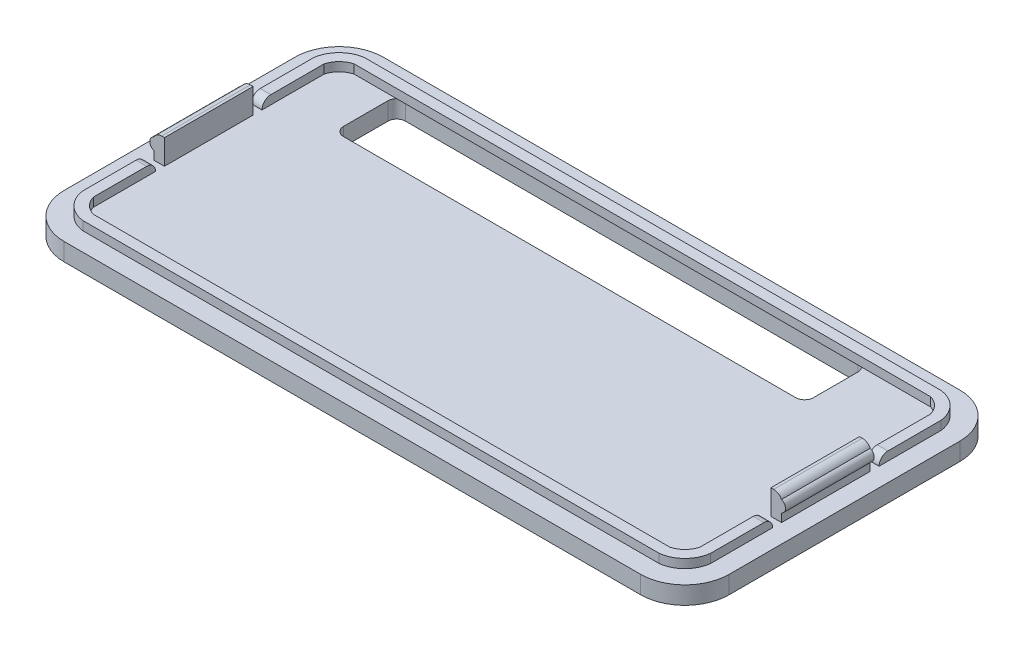
from build123d import *

# Parameters (mm, degrees)
EXTRUDE_2_DEPTH     = 2
EXTRUDE_4_DEPTH     = 1
SKETCH_7_W          = 1.2
SKETCH_7_H          = 10
EXTRUDE_8_DEPTH     = 2.8
SKETCH_8_R          = 0.7
EXTRUDE_9_DEPTH     = 10
FILLET_1_R          = 1
SKETCH_11_W         = 1
SKETCH_11_H         = 1
CUT_EXTRUDE_1_DEPTH = 1.2
FILLET_2_R          = 1
SKETCH_12_W         = 0.815007945
SKETCH_12_H         = 4.86663949
CUT_EXTRUDE_2_DEPTH = 0.5
SKETCH_13_W         = 53
SKETCH_13_H         = 7
CUT_EXTRUDE_3_DEPTH = 2
FILLET_3_R          = 1
SKETCH_14_W         = 1.2
SKETCH_14_H         = 10
EXTRUDE_10_DEPTH    = 1.8
SKETCH_15_R         = 0.7
EXTRUDE_11_DEPTH    = 10
FILLET_4_R          = 1
SKETCH_16_W         = 1.2
SKETCH_16_H         = 1
CUT_EXTRUDE_4_DEPTH = 1
FILLET_5_R          = 1


# Some blends are built 0.0001 mm under size
with BuildPart() as part:
    # case 2 → 凸台-拉伸2 (new body)
    with BuildSketch(Plane(origin=(0, 0, 0), x_dir=(1, 0, 0), z_dir=(0, 1, 0))):
        with BuildLine():
            Line((-34.042196447, 18), (30.957803553, 18))
            ThreePointArc((30.957803553, 18), (34.493337459, 16.535533906), (35.957803553, 13))
            Line((35.957803553, 13), (35.957803553, -13))
            ThreePointArc((35.957803553, -13), (34.493337459, -16.535533906), (30.957803553, -18))
            Line((30.957803553, -18), (-34.042196447, -18))
            ThreePointArc((-34.042196447, -18), (-37.577730353, -16.535533906), (-39.042196447, -13))
            Line((-39.042196447, -13), (-39.042196447, 13))
            ThreePointArc((-39.042196447, 13), (-37.577730353, 16.535533906), (-34.042196447, 18))
        make_face()
    extrude(amount=EXTRUDE_2_DEPTH)

    # 草图3 → 凸台-拉伸4 (add)
    with BuildSketch(Plane(origin=(0, 2, 0), x_dir=(1, 0, 0), z_dir=(0, 1, 0))):
        with BuildLine():
            Line((-36.942196447, 13), (-36.942196447, -13))
            ThreePointArc((-36.942196447, -13), (-35.997398295, -14.955201848), (-34.042196447, -15.9))
            Line((-34.042196447, -15.9), (30.957803553, -15.9))
            ThreePointArc((30.957803553, -15.9), (32.913005401, -14.955201848), (33.857803553, -13))
            Line((33.857803553, -13), (33.857803553, 13))
            ThreePointArc((33.857803553, 13), (32.913005401, 14.955201848), (30.957803553, 15.9))
            Line((30.957803553, 15.9), (-34.042196447, 15.9))
            ThreePointArc((-34.042196447, 15.9), (-35.997398295, 14.955201848), (-36.942196447, 13))
        make_face()
        with BuildLine():
            Line((-34.042196447, -14.7), (30.957803553, -14.7))
            ThreePointArc((30.957803553, -14.7), (32.036016745, -14.078213193), (32.657803553, -13))
            Line((32.657803553, -13), (32.657803553, 13))
            ThreePointArc((32.657803553, 13), (32.036016745, 14.078213193), (30.957803553, 14.7))
            Line((30.957803553, 14.7), (-34.042196447, 14.7))
            ThreePointArc((-34.042196447, 14.7), (-35.12040964, 14.078213193), (-35.742196447, 13))
            Line((-35.742196447, 13), (-35.742196447, -13))
            ThreePointArc((-35.742196447, -13), (-35.12040964, -14.078213193), (-34.042196447, -14.7))
        make_face(mode=Mode.SUBTRACT)
    extrude(amount=EXTRUDE_4_DEPTH)

    # 草图7 → 凸台-拉伸8 (add)
    with BuildSketch(Plane(origin=(0, 2, 0), x_dir=(1, 0, 0), z_dir=(0, 1, 0))):
        with Locations((-36.342196447, 0)):
            Rectangle(SKETCH_7_W, SKETCH_7_H)
    extrude(amount=EXTRUDE_8_DEPTH)

    # 草图8 → 凸台-拉伸9 (add)
    with BuildSketch(Plane.XY.offset(5)):
        with Locations((-36.692196447, 3.6)):
            Circle(SKETCH_8_R)
    extrude(amount=-EXTRUDE_9_DEPTH)

    # 圆角1
    # the kernel refuses this fillet: 1 mm, written as the material it takes off along each edge
    with BuildSketch(Plane(origin=(-36.942196447, 4.8, 7.227714547), x_dir=(0, -1, 0), z_dir=(0, 0, -1))) as fillet_1_piece_1:
        with BuildLine():
            CenterArc((1, -0.891085819), FILLET_1_R, 116.989990913, 63.010009087)
            Line((0, -0.891085819), (-0.02, -0.891085819))
            Line((-0.02, -0.891085819), (-0.02, 0))
            Line((-0.02, 0), (0, 0.02))
            ThreePointArc((0, 0.02), (0.273082579, 0.02), (0.537088462, 0.017821716))
            Line((0.537088462, 0.017821716), (0.546165158, 0))
        make_face()
    extrude(amount=14.455429094, mode=Mode.SUBTRACT)

    # 草图11 → 切除-拉伸1 (cut)
    with BuildSketch(Plane.ZY.offset(36.942196447)):
        with Locations((5.5, 2.5)):
            Rectangle(SKETCH_11_W, SKETCH_11_H)
        with Locations((-5.5, 2.5)):
            Rectangle(SKETCH_11_W, SKETCH_11_H)
    extrude(amount=-CUT_EXTRUDE_1_DEPTH, mode=Mode.SUBTRACT)

    # 圆角2
    fillet_2_edges = [part.edges().sort_by_distance(p)[0] for p in [
        (-36.342196447, 3, 6),
        (-36.342196447, 3, -6),
    ]]
    fillet(fillet_2_edges, radius=FILLET_2_R - 0.0001)  # a hair under: the kernel refuses the full size

    # 草图12 → 切除-拉伸2 (cut)
    # profile 1 of 9: a face of its own
    with BuildSketch(Plane(origin=(0, 0, 0), x_dir=(-1, 0, 0), z_dir=(0, -1, 0))):
        with BuildLine():
            Line((-8.199275743, 1.42603156), (-9.01984878, 1.899029726))
            Line((-9.01984878, 1.899029726), (-13.276727931, 4.355148964))
            Line((-13.276727931, 4.355148964), (-14.097300969, 4.833851351))
            add(Edge.make_bspline(
                [(-14.097300969, 4.833851351), (-14.365190658, 4.981987184), (-14.661462323, 5.061776712), (-14.957803553, 5.061776712)],
                knots=[3, 3, 3, 3, 4, 4, 4, 4], degree=3))
            add(Edge.make_bspline(
                [(-14.957803553, 5.061776712), (-15.254144782, 5.061776712), (-15.550486011, 4.981987184), (-15.818306136, 4.833851351)],
                knots=[4, 4, 4, 4, 5, 5, 5, 5], degree=3))
            Line((-15.818306136, 4.833851351), (-16.638948738, 4.355148964))
            Line((-16.638948738, 4.355148964), (-20.895827889, 1.899029726))
            Line((-20.895827889, 1.899029726), (-21.71647049, 1.42603156))
            add(Edge.make_bspline(
                [(-21.71647049, 1.42603156), (-22.24640652, 1.118316671), (-22.576973074, 0.548451095), (-22.576973074, -0.061309244)],
                knots=[8, 8, 8, 8, 9, 9, 9, 9], degree=3))
            Line((-22.576973074, -0.061309244), (-22.576973074, -6.876914044))
            add(Edge.make_bspline(
                [(-22.576973074, -6.876914044), (-22.576973074, -7.492343823), (-22.24640652, -8.056539959), (-21.71647049, -8.364254848)],
                knots=[10, 10, 10, 10, 11, 11, 11, 11], degree=3))
            Line((-21.71647049, -8.364254848), (-20.895827889, -8.837253014))
            Line((-20.895827889, -8.837253014), (-16.638948738, -11.293372252))
            Line((-16.638948738, -11.293372252), (-15.818306136, -11.772039857))
            add(Edge.make_bspline(
                [(-15.818306136, -11.772039857), (-15.550486011, -11.925914693), (-15.254144782, -12), (-14.957803553, -12)],
                knots=[14, 14, 14, 14, 15, 15, 15, 15], degree=3))
            add(Edge.make_bspline(
                [(-14.957803553, -12), (-14.661462323, -12), (-14.365190658, -11.925914693), (-14.097300969, -11.772039857)],
                knots=[15, 15, 15, 15, 16, 16, 16, 16], degree=3))
            Line((-14.097300969, -11.772039857), (-13.276727931, -11.293372252))
            Line((-13.276727931, -11.293372252), (-9.01984878, -8.837253014))
            Line((-9.01984878, -8.837253014), (-8.199275743, -8.364254848))
            add(Edge.make_bspline(
                [(-8.199275743, -8.364254848), (-7.663565929, -8.056539959), (-7.338773159, -7.492343823), (-7.338773159, -6.876914044)],
                knots=[19, 19, 19, 19, 20, 20, 20, 20], degree=3))
            Line((-7.338773159, -6.876914044), (-7.338773159, -0.061309244))
            add(Edge.make_bspline(
                [(-7.338773159, -0.061309244), (-7.338773159, 0.548451095), (-7.663565929, 1.118316671), (-8.199275743, 1.42603156)],
                knots=[21, 21, 21, 21, 22, 22, 22, 22], degree=3))
        make_face()
        with BuildLine():
            Line((-20.622303543, 0.747890134), (-15.356751194, 3.790987609))
            add(Edge.make_bspline(
                [(-15.356751194, 3.790987609), (-15.111678388, 3.933454003), (-14.803928717, 3.933454003), (-14.553221255, 3.790987609)],
                knots=[3, 3, 3, 3, 4, 4, 4, 4], degree=3))
            Line((-14.553221255, 3.790987609), (-9.31619001, 0.742185913))
            add(Edge.make_bspline(
                [(-9.31619001, 0.742185913), (-9.048369885, 0.588345859), (-9.042665664, 0.200841442), (-9.310485789, 0.041262386)],
                knots=[5, 5, 5, 5, 6, 6, 6, 6], degree=3))
            Line((-9.310485789, 0.041262386), (-14.399346419, -3.001800308))
            add(Edge.make_bspline(
                [(-14.399346419, -3.001800308), (-14.741321415, -3.201274128), (-15.168720597, -3.201274128), (-15.510626029, -3.001800308)],
                knots=[7, 7, 7, 7, 8, 8, 8, 8], degree=3))
            add(Edge.make_bspline(
                [(-15.510626029, -3.001800308), (-20.662163525, -0.027118701), (-20.673571967, -0.02141448)],
                knots=[0, 0, 0, 1, 1, 1], degree=2))
            add(Edge.make_bspline(
                [(-20.673571967, -0.02141448), (-20.941392092, 0.172320338), (-20.912940551, 0.582641639), (-20.622303543, 0.747890134)],
                knots=[1, 1, 1, 1, 2, 2, 2, 2], degree=3))
        make_face(mode=Mode.SUBTRACT)
        with BuildLine():
            Line((-12.820807646, -8.159111588), (-13.413490104, -8.489608579))
            Line((-13.413490104, -8.489608579), (-13.413490104, -7.406884855))
            Line((-13.413490104, -7.406884855), (-12.889258296, -7.144734169))
            add(Edge.make_bspline(
                [(-11.931853522, -5.759964996), (-11.931853522, -6.301344248), (-12.239533629, -6.780011854), (-12.889258296, -7.144734169)],
                knots=[0, 0, 0, 0, 1, 1, 1, 1], degree=3))
            add(Edge.make_bspline(
                [(-12.923414057, -5.571899617), (-12.285167396, -5.207212083), (-11.931853522, -5.201507862), (-11.931853522, -5.759964996)],
                knots=[6, 6, 6, 6, 7, 7, 7, 7], degree=3))
            Line((-12.923414057, -5.571899617), (-13.413490104, -5.845458745))
            add(Edge.make_bspline(
                [(-13.470532313, -5.942326153), (-13.470532313, -5.902431389), (-13.44771543, -5.862536625), (-13.413490104, -5.845458745)],
                knots=[4, 4, 4, 4, 5, 5, 5, 5], degree=3))
            Line((-13.470532313, -5.942326153), (-13.470532313, -7.287200563))
            Line((-13.470532313, -7.287200563), (-13.470532313, -8.58651077))
            Line((-13.470532313, -8.58651077), (-13.470532313, -10.296107495))
            add(Edge.make_bspline(
                [(-13.470532313, -10.296107495), (-13.470532313, -10.336002259), (-13.487575412, -10.370192803), (-13.527435394, -10.392974904)],
                knots=[3, 3, 3, 3, 4, 4, 4, 4], degree=3))
            Line((-13.527435394, -10.392974904), (-14.633010783, -11.019813124))
            add(Edge.make_bspline(
                [(-14.633010783, -11.019813124), (-14.70709609, -11.059707888), (-14.79829406, -11.008439464), (-14.79829406, -10.922945715)],
                knots=[5, 5, 5, 5, 6, 6, 6, 6], degree=3))
            Line((-14.79829406, -10.922945715), (-14.79829406, -5.645984924))
            add(Edge.make_bspline(
                [(-14.79829406, -5.645984924), (-14.79829406, -5.60609016), (-14.781181398, -5.566195396), (-14.741321415, -5.549117515)],
                knots=[7, 7, 7, 7, 8, 8, 8, 8], degree=3))
            Line((-14.741321415, -5.549117515), (-12.860737192, -4.483471672))
            add(Edge.make_bspline(
                [(-12.860737192, -4.483471672), (-11.641216513, -3.793921805), (-10.632612879, -3.657159632), (-10.632612879, -5.024850925)],
                knots=[9, 9, 9, 9, 10, 10, 10, 10], degree=3))
            add(Edge.make_bspline(
                [(-10.632612879, -5.024850925), (-10.632612879, -6.341239012), (-11.652624955, -7.498048043), (-12.820807646, -8.159111588)],
                knots=[10, 10, 10, 10, 11, 11, 11, 11], degree=3))
        make_face(mode=Mode.SUBTRACT)
        with BuildLine():
            Line((-8.917311932, -7.805797714), (-10.011409316, -8.426931714))
            add(Edge.make_bspline(
                [(-10.011409316, -8.426931714), (-10.085494623, -8.466826478), (-10.176692593, -8.415523272), (-10.176692593, -8.330064305)],
                knots=[2, 2, 2, 2, 3, 3, 3, 3], degree=3))
            Line((-10.176692593, -8.330064305), (-10.176692593, -5.81693764))
            add(Edge.make_bspline(
                [(-10.176692593, -5.81693764), (-10.176692593, -5.777077658), (-10.15387571, -5.742852333), (-10.119650385, -5.720070231)],
                knots=[4, 4, 4, 4, 5, 5, 5, 5], degree=3))
            Line((-10.119650385, -5.720070231), (-9.025553001, -5.104605671))
            add(Edge.make_bspline(
                [(-9.025553001, -5.104605671), (-8.951467694, -5.064745689), (-8.860269724, -5.116014113), (-8.860269724, -5.201507862)],
                knots=[6, 6, 6, 6, 7, 7, 7, 7], degree=3))
            Line((-8.860269724, -5.201507862), (-8.860269724, -7.708895524))
            add(Edge.make_bspline(
                [(-8.860269724, -7.708895524), (-8.860269724, -7.748790288), (-8.883086607, -7.788685052), (-8.917311932, -7.805797714)],
                knots=[0, 0, 0, 0, 1, 1, 1, 1], degree=3))
        make_face(mode=Mode.SUBTRACT)
        with BuildLine():
            add(Edge.make_bspline(
                [(-9.515629048, -3.43490371), (-9.076821425, -3.184161466), (-8.763437097, -3.292437316), (-8.763437097, -3.691350175), (-8.763437097, -4.084558813), (-9.076821425, -4.546148538), (-9.515629048, -4.791186561)],
                knots=[2, 2, 2, 2, 3, 3, 3, 4, 4, 4, 4], degree=3))
            add(Edge.make_bspline(
                [(-9.515629048, -4.791186561), (-9.960071328, -5.047633027), (-10.27352522, -4.939357176), (-10.27352522, -4.546148538), (-10.27352522, -4.141531458), (-9.960071328, -3.685645954), (-9.515629048, -3.43490371)],
                knots=[0, 0, 0, 0, 1, 1, 1, 2, 2, 2, 2], degree=3))
        make_face(mode=Mode.SUBTRACT)
    # profile 2 of 9: a face of its own
    with BuildSketch(Plane(origin=(0, 0, 0), x_dir=(-1, 0, 0), z_dir=(0, -1, 0))):
        with BuildLine():
            Line((-3.344009912, -0.540011631), (-5.218889915, -0.540011631))
            Line((-5.218889915, -0.540011631), (-5.218889915, -7.104839405))
            Line((-5.218889915, -7.104839405), (-4.386838872, -7.104839405))
            Line((-4.386838872, -7.104839405), (-4.386838872, -4.500549553))
            Line((-4.386838872, -4.500549553), (-3.298376145, -4.500549553))
            add(Edge.make_bspline(
                [(-3.298376145, -4.500549553), (-1.868007986, -4.500549553), (-0.882151672, -3.850929231), (-0.882151672, -2.466125276)],
                knots=[5, 5, 5, 5, 6, 6, 6, 6], degree=3))
            add(Edge.make_bspline(
                [(-0.882151672, -2.466125276), (-0.882151672, -1.030087678), (-1.868007986, -0.540011631), (-3.344009912, -0.540011631)],
                knots=[6, 6, 6, 6, 7, 7, 7, 7], degree=3))
        make_face()
        with BuildLine():
            Line((-3.406617214, -3.828112348), (-4.386838872, -3.828112348))
            Line((-4.386838872, -3.828112348), (-4.386838872, -1.212448836))
            Line((-4.386838872, -1.212448836), (-3.440842539, -1.212448836))
            add(Edge.make_bspline(
                [(-3.440842539, -1.212448836), (-2.289702947, -1.212448836), (-1.70842893, -1.514459504), (-1.70842893, -2.466125276)],
                knots=[3, 3, 3, 3, 4, 4, 4, 4], degree=3))
            add(Edge.make_bspline(
                [(-1.70842893, -2.466125276), (-1.70842893, -3.406417388), (-2.249842965, -3.828112348), (-3.406617214, -3.828112348)],
                knots=[4, 4, 4, 4, 5, 5, 5, 5], degree=3))
        make_face(mode=Mode.SUBTRACT)
    # profile 3 of 9: a face of its own
    with BuildSketch(Plane(origin=(0, 0, 0), x_dir=(-1, 0, 0), z_dir=(0, -1, 0))):
        with Locations((0.602337022, -4.67151966)):
            Rectangle(SKETCH_12_W, SKETCH_12_H)
    # profile 4 of 9: a face of its own
    with BuildSketch(Plane(origin=(0, 0, 0), x_dir=(-1, 0, 0), z_dir=(0, -1, 0))):
        with BuildLine():
            Line((5.716866646, -3.3152542), (4.884885167, -2.984722427))
            add(Edge.make_bspline(
                [(4.884885167, -2.984722427), (4.297906929, -2.751058063), (3.876211968, -2.60859167), (3.876211968, -2.238199915)],
                knots=[1, 1, 1, 1, 2, 2, 2, 2], degree=3))
            add(Edge.make_bspline(
                [(3.876211968, -2.238199915), (3.876211968, -1.884886041), (4.178257418, -1.68541222), (4.674037686, -1.68541222)],
                knots=[2, 2, 2, 2, 3, 3, 3, 3], degree=3))
            add(Edge.make_bspline(
                [(4.674037686, -1.68541222), (5.192565274, -1.68541222), (5.602921356, -1.862069157), (6.041659416, -2.198305151)],
                knots=[3, 3, 3, 3, 4, 4, 4, 4], degree=3))
            Line((6.041659416, -2.198305151), (6.839554697, -1.195336173))
            add(Edge.make_bspline(
                [(6.839554697, -1.195336173), (6.25828068, -0.608392718), (5.4433423, -0.312051488), (4.674037686, -0.312051488)],
                knots=[5, 5, 5, 5, 6, 6, 6, 6], degree=3))
            add(Edge.make_bspline(
                [(4.674037686, -0.312051488), (3.255077969, -0.312051488), (2.252108992, -1.212448836), (2.252108992, -2.329363103)],
                knots=[6, 6, 6, 6, 7, 7, 7, 7], degree=3))
            add(Edge.make_bspline(
                [(2.252108992, -2.329363103), (2.252108992, -3.298141537), (2.907398752, -3.879415554), (3.608391843, -4.158644121)],
                knots=[7, 7, 7, 7, 8, 8, 8, 8], degree=3))
            Line((3.608391843, -4.158644121), (4.457485985, -4.517662216))
            add(Edge.make_bspline(
                [(4.457485985, -4.517662216), (5.02735156, -4.756996018), (5.397778097, -4.882384531), (5.397778097, -5.269888949)],
                knots=[9, 9, 9, 9, 10, 10, 10, 10], degree=3))
            add(Edge.make_bspline(
                [(5.397778097, -5.269888949), (5.397778097, -5.628907043), (5.11854953, -5.851128184), (4.525867072, -5.851128184)],
                knots=[10, 10, 10, 10, 11, 11, 11, 11], degree=3))
            add(Edge.make_bspline(
                [(4.525867072, -5.851128184), (4.001635263, -5.851128184), (3.3804317, -5.571899617), (2.907398752, -5.167317319)],
                knots=[11, 11, 11, 11, 12, 12, 12, 12], degree=3))
            Line((2.907398752, -5.167317319), (2.001401529, -6.272857926))
            add(Edge.make_bspline(
                [(2.001401529, -6.272857926), (2.690916615, -6.905400367), (3.625434942, -7.230227918), (4.491641747, -7.230227918)],
                knots=[13, 13, 13, 13, 14, 14, 14, 14], degree=3))
            add(Edge.make_bspline(
                [(4.491641747, -7.230227918), (6.104405845, -7.230227918), (7.038924172, -6.255745263), (7.038924172, -5.144500435)],
                knots=[14, 14, 14, 14, 15, 15, 15, 15], degree=3))
            add(Edge.make_bspline(
                [(7.038924172, -5.144500435), (7.038924172, -4.204243106), (6.543213468, -3.64575119), (5.716866646, -3.3152542)],
                knots=[15, 15, 15, 15, 16, 16, 16, 16], degree=3))
        make_face()
    # profile 5 of 9: a face of its own
    with BuildSketch(Plane(origin=(0, 0, 0), x_dir=(-1, 0, 0), z_dir=(0, -1, 0))):
        with BuildLine():
            Line((10.822909503, -2.010239772), (10.822909503, -5.349678477))
            add(Edge.make_bspline(
                [(10.822909503, -5.349678477), (10.555089378, -5.725774452), (10.332763892, -5.868240846), (9.973815361, -5.868240846)],
                knots=[1, 1, 1, 1, 2, 2, 2, 2], degree=3))
            add(Edge.make_bspline(
                [(9.973815361, -5.868240846), (9.569163499, -5.868240846), (9.381132902, -5.668801808), (9.381132902, -4.962139278)],
                knots=[2, 2, 2, 2, 3, 3, 3, 3], degree=3))
            Line((9.381132902, -4.962139278), (9.381132902, -2.010239772))
            Line((9.381132902, -2.010239772), (7.791185687, -2.010239772))
            Line((7.791185687, -2.010239772), (7.791185687, -5.161613098))
            add(Edge.make_bspline(
                [(7.791185687, -5.161613098), (7.791185687, -6.4324022), (8.264218635, -7.230227918), (9.375428681, -7.230227918)],
                knots=[6, 6, 6, 6, 7, 7, 7, 7], degree=3))
            add(Edge.make_bspline(
                [(9.375428681, -7.230227918), (10.070647988, -7.230227918), (10.549385157, -6.905400367), (10.971080117, -6.403915878)],
                knots=[7, 7, 7, 7, 8, 8, 8, 8], degree=3))
            Line((10.971080117, -6.403915878), (11.005235879, -6.403915878))
            Line((11.005235879, -6.403915878), (11.119250732, -7.104839405))
            Line((11.119250732, -7.104839405), (12.418491375, -7.104839405))
            Line((12.418491375, -7.104839405), (12.418491375, -2.010239772))
            Line((12.418491375, -2.010239772), (10.822909503, -2.010239772))
        make_face()
    # profile 6 of 9: a face of its own
    with BuildSketch(Plane(origin=(0, 0, 0), x_dir=(-1, 0, 0), z_dir=(0, -1, 0))):
        with BuildLine():
            Line((16.270788228, -6.101870428), (15.467258289, -6.101870428))
            add(Edge.make_bspline(
                [(15.467258289, -6.101870428), (14.920209598, -6.101870428), (14.715066338, -5.993594577), (14.715066338, -5.759964996)],
                knots=[1, 1, 1, 1, 2, 2, 2, 2], degree=3))
            add(Edge.make_bspline(
                [(14.715066338, -5.759964996), (14.715066338, -5.589012279), (14.75492632, -5.509222751), (14.874575831, -5.400946901)],
                knots=[2, 2, 2, 2, 3, 3, 3, 3], degree=3))
            add(Edge.make_bspline(
                [(14.874575831, -5.400946901), (15.096901316, -5.463623766), (15.301975012, -5.492144871), (15.47296251, -5.492144871)],
                knots=[3, 3, 3, 3, 4, 4, 4, 4], degree=3))
            add(Edge.make_bspline(
                [(15.47296251, -5.492144871), (16.601285219, -5.492144871), (17.507421569, -4.973547719), (17.507421569, -3.782548145)],
                knots=[4, 4, 4, 4, 5, 5, 5, 5], degree=3))
            add(Edge.make_bspline(
                [(17.507421569, -3.782548145), (17.507421569, -3.53747534), (17.44467514, -3.303845758), (17.364955175, -3.161379364)],
                knots=[5, 5, 5, 5, 6, 6, 6, 6], degree=3))
            Line((17.364955175, -3.161379364), (18.151302888, -3.161379364))
            Line((18.151302888, -3.161379364), (18.151302888, -2.010239772))
            Line((18.151302888, -2.010239772), (16.28219667, -2.010239772))
            add(Edge.make_bspline(
                [(16.28219667, -2.010239772), (16.048532306, -1.924780805), (15.769303739, -1.884886041), (15.47296251, -1.884886041)],
                knots=[9, 9, 9, 9, 10, 10, 10, 10], degree=3))
            add(Edge.make_bspline(
                [(15.47296251, -1.884886041), (14.373160906, -1.884886041), (13.341670824, -2.488942159), (13.341670824, -3.73694916)],
                knots=[10, 10, 10, 10, 11, 11, 11, 11], degree=3))
            add(Edge.make_bspline(
                [(13.341670824, -3.73694916), (13.341670824, -4.329596837), (13.672237378, -4.802595003), (14.03118591, -5.053337247)],
                knots=[11, 11, 11, 11, 12, 12, 12, 12], degree=3))
            Line((14.03118591, -5.053337247), (14.03118591, -5.087527791))
            add(Edge.make_bspline(
                [(14.03118591, -5.087527791), (13.700688919, -5.321157372), (13.467024555, -5.680175467), (13.467024555, -6.039193562)],
                knots=[13, 13, 13, 13, 14, 14, 14, 14], degree=3))
            add(Edge.make_bspline(
                [(13.467024555, -6.039193562), (13.467024555, -6.466592744), (13.666533158, -6.734447651), (13.934353283, -6.916808808)],
                knots=[14, 14, 14, 14, 15, 15, 15, 15], degree=3))
            Line((13.934353283, -6.916808808), (13.934353283, -6.962373012))
            add(Edge.make_bspline(
                [(13.934353283, -6.962373012), (13.461320335, -7.201741596), (13.210612872, -7.543647028), (13.210612872, -7.965341989)],
                knots=[16, 16, 16, 16, 17, 17, 17, 17], degree=3))
            add(Edge.make_bspline(
                [(13.210612872, -7.965341989), (13.210612872, -8.877112996), (14.173652304, -9.247539533), (15.347608779, -9.247539533)],
                knots=[17, 17, 17, 17, 18, 18, 18, 18], degree=3))
            add(Edge.make_bspline(
                [(15.347608779, -9.247539533), (17.11988237, -9.247539533), (18.23116198, -8.48393914), (18.23116198, -7.406884855)],
                knots=[18, 18, 18, 18, 19, 19, 19, 19], degree=3))
            add(Edge.make_bspline(
                [(18.23116198, -7.406884855), (18.23116198, -6.483705406), (17.524534232, -6.101870428), (16.270788228, -6.101870428)],
                knots=[19, 19, 19, 19, 20, 20, 20, 20], degree=3))
        make_face()
        with BuildLine():
            Line((15.484370952, -7.321391106), (15.968812342, -7.321391106))
            add(Edge.make_bspline(
                [(15.968812342, -7.321391106), (16.441706162, -7.321391106), (16.709595851, -7.384067972), (16.709595851, -7.686113422)],
                knots=[4, 4, 4, 4, 5, 5, 5, 5], degree=3))
            add(Edge.make_bspline(
                [(16.709595851, -7.686113422), (16.709595851, -8.010940974), (16.253745129, -8.250274776), (15.598316241, -8.250274776)],
                knots=[5, 5, 5, 5, 6, 6, 6, 6], degree=3))
            add(Edge.make_bspline(
                [(15.598316241, -8.250274776), (14.943026481, -8.250274776), (14.5156273, -8.073617839), (14.5156273, -7.714599745)],
                knots=[0, 0, 0, 0, 1, 1, 1, 1], degree=3))
            add(Edge.make_bspline(
                [(14.5156273, -7.714599745), (14.5156273, -7.543647028), (14.595347264, -7.401180635), (14.75492632, -7.258714241)],
                knots=[1, 1, 1, 1, 2, 2, 2, 2], degree=3))
            add(Edge.make_bspline(
                [(14.75492632, -7.258714241), (14.920209598, -7.304313226), (15.114013979, -7.321391106), (15.484370952, -7.321391106)],
                knots=[2, 2, 2, 2, 3, 3, 3, 3], degree=3))
        make_face(mode=Mode.SUBTRACT)
        with BuildLine():
            add(Edge.make_bspline(
                [(15.47296251, -4.534740096), (15.108309758, -4.534740096), (14.829081191, -4.266919971), (14.829081191, -3.73694916), (14.829081191, -3.218352009), (15.108309758, -2.950531884), (15.47296251, -2.950531884)],
                knots=[2, 2, 2, 2, 3, 3, 3, 4, 4, 4, 4], degree=3))
            add(Edge.make_bspline(
                [(15.47296251, -2.950531884), (15.849093268, -2.950531884), (16.116913393, -3.218352009), (16.116913393, -3.73694916), (16.116913393, -4.266919971), (15.849093268, -4.534740096), (15.47296251, -4.534740096)],
                knots=[0, 0, 0, 0, 1, 1, 1, 2, 2, 2, 2], degree=3))
        make_face(mode=Mode.SUBTRACT)
    # profile 7 of 9: a face of its own
    with BuildSketch(Plane(origin=(0, 0, 0), x_dir=(-1, 0, 0), z_dir=(0, -1, 0))):
        with BuildLine():
            Line((18.607223174, -2.551619025), (19.165680307, -3.600186987))
            add(Edge.make_bspline(
                [(19.165680307, -3.600186987), (19.67293858, -3.3152542), (20.094633541, -3.155675143), (20.499215839, -3.155675143)],
                knots=[2, 2, 2, 2, 3, 3, 3, 3], degree=3))
            add(Edge.make_bspline(
                [(20.499215839, -3.155675143), (21.017743426, -3.155675143), (21.234364691, -3.395008946), (21.268520453, -3.805330247)],
                knots=[3, 3, 3, 3, 4, 4, 4, 4], degree=3))
            add(Edge.make_bspline(
                [(21.268520453, -3.805330247), (19.27969516, -4.021881948), (18.436235676, -4.603121183), (18.436235676, -5.680175467)],
                knots=[4, 4, 4, 4, 5, 5, 5, 5], degree=3))
            add(Edge.make_bspline(
                [(18.436235676, -5.680175467), (18.436235676, -6.529269609), (19.011805472, -7.230227918), (19.952167147, -7.230227918)],
                knots=[5, 5, 5, 5, 6, 6, 6, 6], degree=3))
            add(Edge.make_bspline(
                [(19.952167147, -7.230227918), (20.516328501, -7.230227918), (20.989291886, -6.968077232), (21.410986846, -6.591981257)],
                knots=[6, 6, 6, 6, 7, 7, 7, 7], degree=3))
            Line((21.410986846, -6.591981257), (21.450846829, -6.591981257))
            Line((21.450846829, -6.591981257), (21.564792118, -7.104839405))
            Line((21.564792118, -7.104839405), (22.864102325, -7.104839405))
            Line((22.864102325, -7.104839405), (22.864102325, -4.209947326))
            add(Edge.make_bspline(
                [(22.864102325, -4.209947326), (22.864102325, -2.61429589), (22.117614594, -1.884886041), (20.801261289, -1.884886041)],
                knots=[11, 11, 11, 11, 12, 12, 12, 12], degree=3))
            add(Edge.make_bspline(
                [(20.801261289, -1.884886041), (20.009070228, -1.884886041), (19.27969516, -2.152706166), (18.607223174, -2.551619025)],
                knots=[0, 0, 0, 0, 1, 1, 1, 1], degree=3))
        make_face()
        with BuildLine():
            Line((21.268520453, -4.774108681), (21.268520453, -5.589012279))
            add(Edge.make_bspline(
                [(21.268520453, -5.589012279), (21.034856089, -5.839754524), (20.824008609, -5.993594577), (20.499215839, -5.993594577)],
                knots=[0, 0, 0, 0, 1, 1, 1, 1], degree=3))
            add(Edge.make_bspline(
                [(20.499215839, -5.993594577), (20.168649284, -5.993594577), (19.952167147, -5.851128184), (19.952167147, -5.554821736)],
                knots=[1, 1, 1, 1, 2, 2, 2, 2], degree=3))
            add(Edge.make_bspline(
                [(19.952167147, -5.554821736), (19.952167147, -5.195803641), (20.276959917, -4.910870854), (21.268520453, -4.774108681)],
                knots=[2, 2, 2, 2, 3, 3, 3, 3], degree=3))
        make_face(mode=Mode.SUBTRACT)
    # profile 8 of 9: a face of its own
    with BuildSketch(Plane(origin=(0, 0, 0), x_dir=(-1, 0, 0), z_dir=(0, -1, 0))):
        with BuildLine():
            Line((25.354481669, -2.893524457), (25.320256344, -2.893524457))
            Line((25.320256344, -2.893524457), (25.212015276, -2.010239772))
            Line((25.212015276, -2.010239772), (23.912705069, -2.010239772))
            Line((23.912705069, -2.010239772), (23.912705069, -7.104839405))
            Line((23.912705069, -7.104839405), (25.496948063, -7.104839405))
            Line((25.496948063, -7.104839405), (25.496948063, -4.192834664))
            add(Edge.make_bspline(
                [(25.496948063, -4.192834664), (25.764768188, -3.520397459), (26.220688474, -3.281063656), (26.596749668, -3.281063656)],
                knots=[7, 7, 7, 7, 8, 8, 8, 8], degree=3))
            add(Edge.make_bspline(
                [(26.596749668, -3.281063656), (26.82470981, -3.281063656), (26.972880425, -3.3152542), (27.155206801, -3.360818403)],
                knots=[8, 8, 8, 8, 9, 9, 9, 9], degree=3))
            Line((27.155206801, -3.360818403), (27.423026926, -1.987457671))
            add(Edge.make_bspline(
                [(27.423026926, -1.987457671), (27.280560532, -1.924780805), (27.109642598, -1.884886041), (26.807597148, -1.884886041)],
                knots=[10, 10, 10, 10, 11, 11, 11, 11], degree=3))
            add(Edge.make_bspline(
                [(26.807597148, -1.884886041), (26.294704217, -1.884886041), (25.730542863, -2.215417813), (25.354481669, -2.893524457)],
                knots=[0, 0, 0, 0, 1, 1, 1, 1], degree=3))
        make_face()
    # profile 9 of 9: a face of its own
    with BuildSketch(Plane(origin=(0, 0, 0), x_dir=(-1, 0, 0), z_dir=(0, -1, 0))):
        with BuildLine():
            add(Edge.make_bspline(
                [(0.605189132, -1.235230937), (0.929981902, -1.235230937), (1.169350486, -1.012975016), (1.169350486, -0.710964347), (1.169350486, -0.374728354), (0.929981902, -0.180993536), (0.605189132, -0.180993536)],
                knots=[2, 2, 2, 2, 3, 3, 3, 4, 4, 4, 4], degree=3))
            add(Edge.make_bspline(
                [(0.605189132, -0.180993536), (0.280396362, -0.180993536), (0.041027778, -0.374728354), (0.041027778, -0.710964347), (0.041027778, -1.012975016), (0.280396362, -1.235230937), (0.605189132, -1.235230937)],
                knots=[0, 0, 0, 0, 1, 1, 1, 2, 2, 2, 2], degree=3))
        make_face()
    extrude(amount=-CUT_EXTRUDE_2_DEPTH, mode=Mode.SUBTRACT)

    # 草图13 → 切除-拉伸3 (cut)
    with BuildSketch(Plane(origin=(0, 0, 0), x_dir=(1, 0, 0), z_dir=(0, 1, 0))):
        with Locations((-3.042196447, 11.5)):
            Rectangle(SKETCH_13_W, SKETCH_13_H)
    extrude(amount=CUT_EXTRUDE_3_DEPTH, mode=Mode.SUBTRACT)

    # 圆角3
    # the kernel refuses this fillet: 1 mm, written as the material it adds along each edge
    with BuildSketch(Plane(origin=(-29.542196447, 0, -15), x_dir=(0, 0, 1), z_dir=(0, 1, 0)), Plane(origin=(-29.542196447, 0, -8), x_dir=(1, 0, 0), z_dir=(0, 1, 0)), Plane(origin=(23.457803553, 0, -8), x_dir=(0, 0, -1), z_dir=(0, 1, 0))) as fillet_3_piece_1:
        with BuildLine():
            CenterArc((FILLET_3_R, FILLET_3_R), FILLET_3_R, 180, 90)
            Line((0, FILLET_3_R), (0, 0))
            Line((0, 0), (FILLET_3_R, 0))
        make_face()
    extrude(amount=2)
    with BuildSketch(Plane(origin=(23.457803553, 0, -15), x_dir=(0, 0, 1), z_dir=(0, 1, 0))) as fillet_3_piece_2:
        with BuildLine():
            CenterArc((FILLET_3_R, -FILLET_3_R), FILLET_3_R, 90, 90)
            Line((0, -FILLET_3_R), (0, 0))
            Line((0, 0), (FILLET_3_R, 0))
        make_face()
    extrude(amount=2)

    # 草图14 → 凸台-拉伸10 (add)
    with BuildSketch(Plane(origin=(0, 3, 0), x_dir=(1, 0, 0), z_dir=(0, 1, 0))):
        with Locations((33.257803553, 0)):
            Rectangle(SKETCH_14_W, SKETCH_14_H)
    extrude(amount=EXTRUDE_10_DEPTH)

    # 草图15 → 凸台-拉伸11 (add)
    with BuildSketch(Plane(origin=(0, 0, -5), x_dir=(-1, 0, 0), z_dir=(0, 0, -1))):
        with Locations((-33.607803553, 3.6)):
            Circle(SKETCH_15_R)
    extrude(amount=-EXTRUDE_11_DEPTH)

    # 圆角4
    # the kernel refuses this fillet: 1 mm, written as the material it takes off along each edge
    with BuildSketch(Plane(origin=(33.857803553, 4.8, 7.227714547), x_dir=(-1, 0, 0), z_dir=(0, 0, -1))) as fillet_4_piece_1:
        with BuildLine():
            CenterArc((0.891085819, -1), FILLET_4_R, 90, 63.010009087)
            Line((0, -0.546165158), (-0.017821716, -0.537088462))
            ThreePointArc((-0.017821716, -0.537088462), (-0.02, -0.273082579), (-0.02, 0))
            Line((-0.02, 0), (0, 0.02))
            Line((0, 0.02), (0.891085819, 0.02))
            Line((0.891085819, 0.02), (0.891085819, 0))
        make_face()
    extrude(amount=14.455429094, mode=Mode.SUBTRACT)

    # 草图16 → 切除-拉伸4 (cut)
    with BuildSketch(Plane(origin=(0, 3, 0), x_dir=(1, 0, 0), z_dir=(0, 1, 0))):
        with Locations((33.257803553, -5.5)):
            Rectangle(SKETCH_16_W, SKETCH_16_H)
        with Locations((33.257803553, 5.5)):
            Rectangle(SKETCH_16_W, SKETCH_16_H)
    extrude(amount=-CUT_EXTRUDE_4_DEPTH, mode=Mode.SUBTRACT)

    # 圆角5
    fillet_5_edges = [part.edges().sort_by_distance(p)[0] for p in [
        (33.257803553, 3, 6),
        (33.257803553, 3, -6),
    ]]
    fillet(fillet_5_edges, radius=FILLET_5_R - 0.0001)  # a hair under: the kernel refuses the full size


solid = part.part
